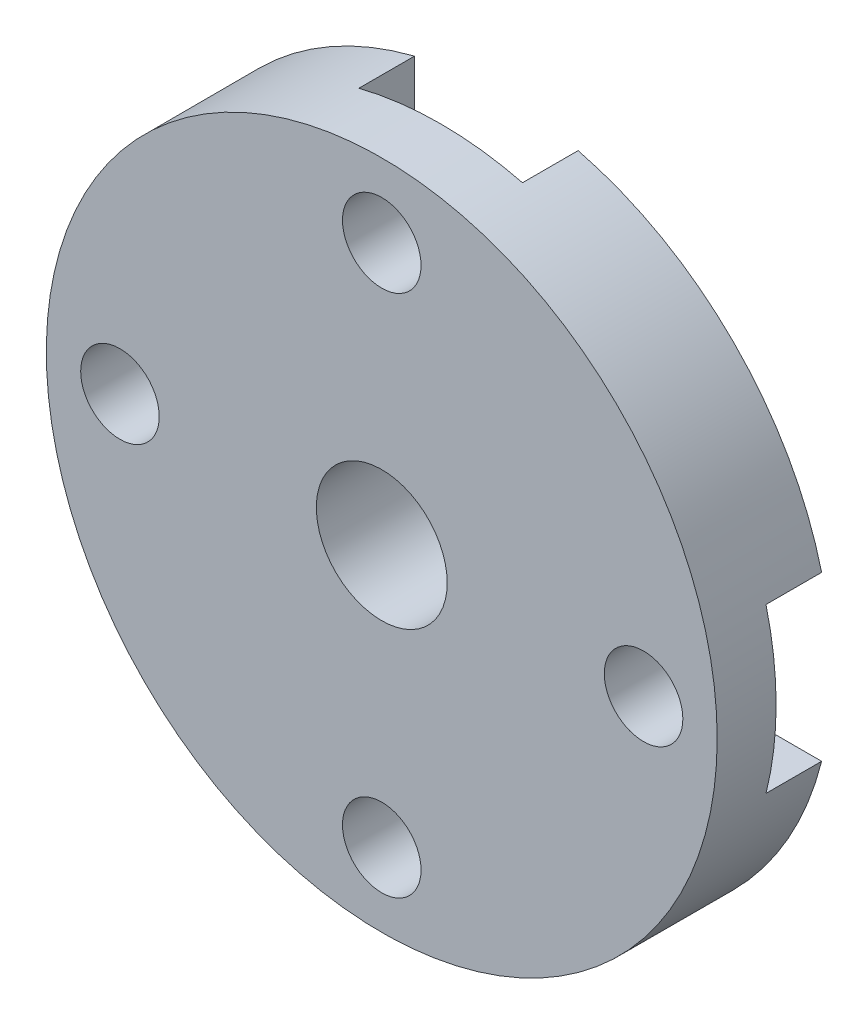
from build123d import *

# Parameters (mm, degrees)
SKETCH1_R              = 10.25
SKETCH1_R_2            = 2
SKETCH1_R_3            = 1.2
BOSS_EXTRUDE1_DEPTH    = 3.5
CUT_EXTRUDE2_START     = -1.7
CUT_EXTRUDE2_OUTLINE_R = 1.2
CUT_EXTRUDE2_DEPTH     = 1.7


# Read off the part's stored shape, not the designer's step: Cut-Extrude2
with BuildPart() as part:
    # Sketch1 → Boss-Extrude1 (new body)
    with BuildSketch(Plane.XY):
        Circle(SKETCH1_R)
        Circle(SKETCH1_R_2, mode=Mode.SUBTRACT)
        with Locations((0, 8)):
            Circle(SKETCH1_R_3, mode=Mode.SUBTRACT)
        with Locations((8, 0)):
            Circle(SKETCH1_R_3, mode=Mode.SUBTRACT)
        with Locations((0, -8)):
            Circle(SKETCH1_R_3, mode=Mode.SUBTRACT)
        with Locations((-8, 0)):
            Circle(SKETCH1_R_3, mode=Mode.SUBTRACT)
    extrude(amount=BOSS_EXTRUDE1_DEPTH)

    # Cut-Extrude2 outline → Cut-Extrude2 (cut)
    # profile 1 of 4: a face of its own
    with BuildSketch(Plane(origin=(0, 0, 0), x_dir=(-1, 0, 0), z_dir=(0, 0, -1)).offset(CUT_EXTRUDE2_START)):
        with BuildLine():
            Line((-9.94069912, -2.499), (-8.098979998, -2.499))
            ThreePointArc((-8.098979998, -2.499), (-5.49948025, -0.050000196), (-8.000999999, 2.4989992))
            Line((-8.000999999, 2.4989992), (-9.940699321, 2.4989992))
            ThreePointArc((-9.940699321, 2.4989992), (-10.25, -4.12e-07), (-9.94069912, -2.499))
        make_face()
        with Locations((-8, 0)):
            Circle(CUT_EXTRUDE2_OUTLINE_R, mode=Mode.SUBTRACT)
    # profile 2 of 4: a face of its own
    with BuildSketch(Plane(origin=(0, 0, 0), x_dir=(-1, 0, 0), z_dir=(0, 0, -1)).offset(CUT_EXTRUDE2_START)):
        with BuildLine():
            Line((-2.498, -8), (-2.498, -9.940950458))
            ThreePointArc((-2.498, -9.940950458), (0.001546691, -10.249999883), (2.501, -9.940196125))
            Line((2.501, -9.940196125), (2.5010004, -8.070689462))
            ThreePointArc((2.5010004, -8.070689462), (0.037348265, -5.500249912), (-2.498, -8))
        make_face()
        with Locations((0, -8)):
            Circle(CUT_EXTRUDE2_OUTLINE_R, mode=Mode.SUBTRACT)
    # profile 3 of 4: a face of its own
    with BuildSketch(Plane(origin=(0, 0, 0), x_dir=(-1, 0, 0), z_dir=(0, 0, -1)).offset(CUT_EXTRUDE2_START)):
        with BuildLine():
            ThreePointArc((2.5, 9.940447676), (0, 10.25), (-2.5, 9.940447676))
            Line((-2.5, 9.940447676), (-2.5, 8))
            ThreePointArc((-2.5, 8), (0, 5.5), (2.5, 8))
            Line((2.5, 8), (2.5, 9.940447676))
        make_face()
        with Locations((0, 8)):
            Circle(CUT_EXTRUDE2_OUTLINE_R, mode=Mode.SUBTRACT)
    # profile 4 of 4: a face of its own
    with BuildSketch(Plane(origin=(0, 0, 0), x_dir=(-1, 0, 0), z_dir=(0, 0, -1)).offset(CUT_EXTRUDE2_START)):
        with BuildLine():
            Line((8.001, -2.499), (9.94069912, -2.499))
            ThreePointArc((9.94069912, -2.499), (10.249999948, 0.001031141), (9.940196125, 2.501))
            Line((9.940196125, 2.501), (8.001, 2.501))
            ThreePointArc((8.001, 2.501), (5.501, 0.001), (8.001, -2.499))
        make_face()
        with Locations((8, 0)):
            Circle(CUT_EXTRUDE2_OUTLINE_R, mode=Mode.SUBTRACT)
    extrude(amount=CUT_EXTRUDE2_DEPTH, mode=Mode.SUBTRACT)


solid = part.part
